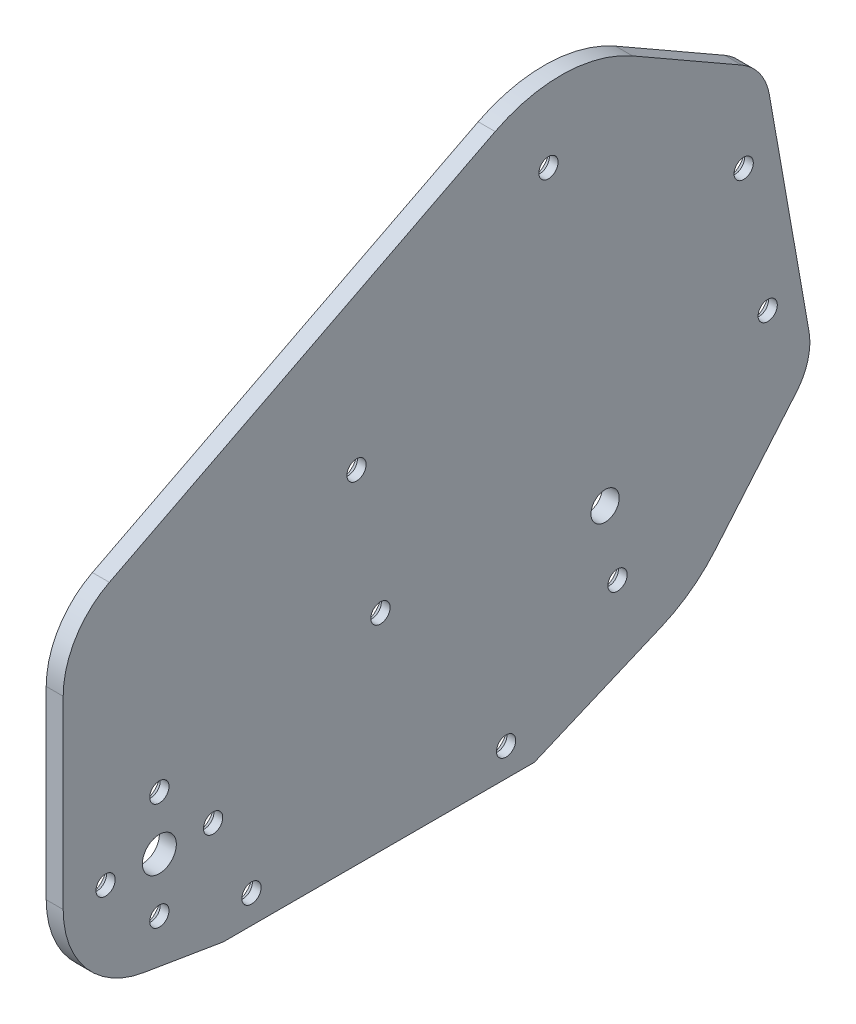
from build123d import *

# Parameters (mm, degrees)
BOSS_EXTRUDE1_DEPTH                            = 3
CSK_FOR_M3_FLAT_HEAD_MACHINE_SCREW1_AT_2_COUNT = 2
CSK_FOR_M3_FLAT_HEAD_MACHINE_SCREW1_AT_2_PITCH = 24.249778845
CSK_FOR_M3_FLAT_HEAD_MACHINE_SCREW1_AT_3_COUNT = 2
CSK_FOR_M3_FLAT_HEAD_MACHINE_SCREW1_AT_3_PITCH = 38.620366786
CSK_FOR_M3_FLAT_HEAD_MACHINE_SCREW1_AT_4_COUNT = 2
CSK_FOR_M3_FLAT_HEAD_MACHINE_SCREW1_AT_4_PITCH = 56.46506966
CSK_FOR_M3_FLAT_HEAD_MACHINE_SCREW1_AT_5_COUNT = 2
CSK_FOR_M3_FLAT_HEAD_MACHINE_SCREW1_AT_5_PITCH = 73.574936218
CSK_FOR_M3_FLAT_HEAD_MACHINE_SCREW1_AT_6_COUNT = 2
CSK_FOR_M3_FLAT_HEAD_MACHINE_SCREW1_AT_6_PITCH = 69.463901996
CSK_FOR_M3_FLAT_HEAD_MACHINE_SCREW1_AT_7_COUNT = 2
CSK_FOR_M3_FLAT_HEAD_MACHINE_SCREW1_AT_7_PITCH = 110.058179925
CSK_FOR_M3_FLAT_HEAD_MACHINE_SCREW1_AT_8_COUNT = 2
CSK_FOR_M3_FLAT_HEAD_MACHINE_SCREW1_AT_8_PITCH = 79.426938293
CSK_FOR_M3_FLAT_HEAD_MACHINE_SCREW1_AT_9_COUNT = 2
CSK_FOR_M3_FLAT_HEAD_MACHINE_SCREW1_AT_9_PITCH = 112.183995682
CSK_FOR_M3_FLAT_HEAD_MACHINE_SCREW1_AT_1_COUNT = 2
CSK_FOR_M3_FLAT_HEAD_MACHINE_SCREW1_AT_1_PITCH = 124.741332913
CSK_FOR_M3_FLAT_HEAD_MACHINE_SCREW1_2_COUNT    = 2
CSK_FOR_M3_FLAT_HEAD_MACHINE_SCREW1_2_PITCH    = 120.876336016
CSK_FOR_M3_FLAT_HEAD_MACHINE_SCREW1_3_COUNT    = 2
CSK_FOR_M3_FLAT_HEAD_MACHINE_SCREW1_3_PITCH    = 107.870002128
HOLE1_D                                        = 5
HOLE2_D                                        = 6


with BuildPart() as part:
    # Sketch2 → Boss-Extrude1 (new body)
    with BuildSketch(Plane.ZY.offset(20)):
        with BuildLine():
            Line((47.619897679, 102.108971987), (-20.56586036, 137.014944855))
            ThreePointArc((-20.56586036, 137.014944855), (-32.783546974, 139.809342763), (-44.856843921, 136.445412513))
            Line((-44.856843921, 136.445412513), (-64.147238229, 125.399811115))
            ThreePointArc((-64.147238229, 125.399811115), (-67.359474123, 122.47213667), (-69.026291478, 118.458228724))
            Line((-69.026291478, 118.458228724), (-76.03531425, 78.708085309))
            ThreePointArc((-76.03531425, 78.708085309), (-75.841855651, 74.366160521), (-73.824664919, 70.516397068))
            Line((-73.824664919, 70.516397068), (-59.475441909, 53.539223516))
            ThreePointArc((-59.475441909, 53.539223516), (-55.128189361, 49.472265428), (-49.95644752, 46.524072909))
            Line((-49.95644752, 46.524072909), (-27.5, 37))
            Line((-27.5, 37), (27.5, 37))
            Line((27.5, 37), (41.571151011, 39.338075833))
            ThreePointArc((41.571151011, 39.338075833), (51.753255927, 45.116581364), (55.784620241, 56.108145787))
            Line((55.784620241, 56.108145787), (55.784620241, 88.756856712))
            ThreePointArc((55.784620241, 88.756856712), (53.581673839, 96.582163045), (47.619897679, 102.108971987))
        make_face()
    extrude(amount=BOSS_EXTRUDE1_DEPTH)

    # Sketch4 → CSK for M3 Flat Head Machine Screw1 (revolve, cut)
    with BuildSketch(Plane(origin=(-23, 109.419717404, -64.490716019), x_dir=(0, 0, 1), z_dir=(0, 1, 0))):
        Polygon((0, 0), (0, 3), (1.7, 3), (1.7, 1.45), (3.15, 0), align=None)
    csk_for_m3_flat_head_machine_screw1 = revolve(axis=Axis((-29.35, 109.419717404, -64.490716019), (1, 0, 0)), mode=Mode.SUBTRACT)

    # CSK for M3 Flat Head Machine Screw1 at 2: CSK for M3 Flat Head Machine Screw1 ×2
    with Locations(*[Vector(1.2086661918509005e-15, -0.9845474999613613, -0.1751177327395301) * (i * CSK_FOR_M3_FLAT_HEAD_MACHINE_SCREW1_AT_2_PITCH) for i in range(1, CSK_FOR_M3_FLAT_HEAD_MACHINE_SCREW1_AT_2_COUNT)]):
        add(csk_for_m3_flat_head_machine_screw1, mode=Mode.SUBTRACT)

    # CSK for M3 Flat Head Machine Screw1 at 3: CSK for M3 Flat Head Machine Screw1 ×2
    with Locations(*[Vector(-6.2093706838556256e-15, 0.4493600398438155, 0.8933507455594162) * (i * CSK_FOR_M3_FLAT_HEAD_MACHINE_SCREW1_AT_3_PITCH) for i in range(1, CSK_FOR_M3_FLAT_HEAD_MACHINE_SCREW1_AT_3_COUNT)]):
        add(csk_for_m3_flat_head_machine_screw1, mode=Mode.SUBTRACT)

    # CSK for M3 Flat Head Machine Screw1 at 4: CSK for M3 Flat Head Machine Screw1 ×2
    with Locations(*[Vector(-2.752696921896813e-15, -0.9187544758485509, 0.39482934681739995) * (i * CSK_FOR_M3_FLAT_HEAD_MACHINE_SCREW1_AT_4_PITCH) for i in range(1, CSK_FOR_M3_FLAT_HEAD_MACHINE_SCREW1_AT_4_COUNT)]):
        add(csk_for_m3_flat_head_machine_screw1, mode=Mode.SUBTRACT)

    # CSK for M3 Flat Head Machine Screw1 at 5: CSK for M3 Flat Head Machine Screw1 ×2
    with Locations(*[Vector(-6.072091503896428e-15, -0.48853059658848386, 0.8725467644756355) * (i * CSK_FOR_M3_FLAT_HEAD_MACHINE_SCREW1_AT_5_PITCH) for i in range(1, CSK_FOR_M3_FLAT_HEAD_MACHINE_SCREW1_AT_5_COUNT)]):
        add(csk_for_m3_flat_head_machine_screw1, mode=Mode.SUBTRACT)

    # CSK for M3 Flat Head Machine Screw1 at 6: CSK for M3 Flat Head Machine Screw1 ×2
    with Locations(*[Vector(-6.853396070159123e-15, -0.1720373859496981, 0.9850904211470106) * (i * CSK_FOR_M3_FLAT_HEAD_MACHINE_SCREW1_AT_6_PITCH) for i in range(1, CSK_FOR_M3_FLAT_HEAD_MACHINE_SCREW1_AT_6_COUNT)]):
        add(csk_for_m3_flat_head_machine_screw1, mode=Mode.SUBTRACT)

    # CSK for M3 Flat Head Machine Screw1 at 7: CSK for M3 Flat Head Machine Screw1 ×2
    with Locations(*[Vector(-5.503795198596271e-15, -0.6125825218052937, 0.790406638369559) * (i * CSK_FOR_M3_FLAT_HEAD_MACHINE_SCREW1_AT_7_PITCH) for i in range(1, CSK_FOR_M3_FLAT_HEAD_MACHINE_SCREW1_AT_7_COUNT)]):
        add(csk_for_m3_flat_head_machine_screw1, mode=Mode.SUBTRACT)

    # CSK for M3 Flat Head Machine Screw1 at 8: CSK for M3 Flat Head Machine Screw1 ×2
    with Locations(*[Vector(-3.678987335552319e-15, -0.8488268445511623, 0.528670963803874) * (i * CSK_FOR_M3_FLAT_HEAD_MACHINE_SCREW1_AT_8_PITCH) for i in range(1, CSK_FOR_M3_FLAT_HEAD_MACHINE_SCREW1_AT_8_COUNT)]):
        add(csk_for_m3_flat_head_machine_screw1, mode=Mode.SUBTRACT)

    # CSK for M3 Flat Head Machine Screw1 at 9: CSK for M3 Flat Head Machine Screw1 ×2
    with Locations(*[Vector(-6.412897985867183e-15, -0.3905331714248384, 0.9205888561224592) * (i * CSK_FOR_M3_FLAT_HEAD_MACHINE_SCREW1_AT_9_PITCH) for i in range(1, CSK_FOR_M3_FLAT_HEAD_MACHINE_SCREW1_AT_9_COUNT)]):
        add(csk_for_m3_flat_head_machine_screw1, mode=Mode.SUBTRACT)

    # CSK for M3 Flat Head Machine Screw1 at 1: CSK for M3 Flat Head Machine Screw1 ×2
    with Locations(*[Vector(-6.29422265002457e-15, -0.42737695976117984, 0.9040735225994017) * (i * CSK_FOR_M3_FLAT_HEAD_MACHINE_SCREW1_AT_1_PITCH) for i in range(1, CSK_FOR_M3_FLAT_HEAD_MACHINE_SCREW1_AT_1_COUNT)]):
        add(csk_for_m3_flat_head_machine_screw1, mode=Mode.SUBTRACT)

    # CSK for M3 Flat Head Machine Screw1  2: CSK for M3 Flat Head Machine Screw1 ×2
    with Locations(*[Vector(-5.951739965557826e-15, -0.5196349731227424, 0.8543883746328287) * (i * CSK_FOR_M3_FLAT_HEAD_MACHINE_SCREW1_2_PITCH) for i in range(1, CSK_FOR_M3_FLAT_HEAD_MACHINE_SCREW1_2_COUNT)]):
        add(csk_for_m3_flat_head_machine_screw1, mode=Mode.SUBTRACT)

    # CSK for M3 Flat Head Machine Screw1  3: CSK for M3 Flat Head Machine Screw1 ×2
    with Locations(*[Vector(-6.0518320719738365e-15, -0.49422054848795993, 0.8693365570665138) * (i * CSK_FOR_M3_FLAT_HEAD_MACHINE_SCREW1_3_PITCH) for i in range(1, CSK_FOR_M3_FLAT_HEAD_MACHINE_SCREW1_3_COUNT)]):
        add(csk_for_m3_flat_head_machine_screw1, mode=Mode.SUBTRACT)

    # Hole1 (through all)
    with Locations(Plane.ZY.offset(23)):
        with Locations((-40, 70)):
            Hole(HOLE1_D / 2)

    # Hole2 (through all)
    with Locations(Plane.ZY.offset(23)):
        with Locations((38.784620241, 56.108145787)):
            Hole(HOLE2_D / 2)


solid = part.part
